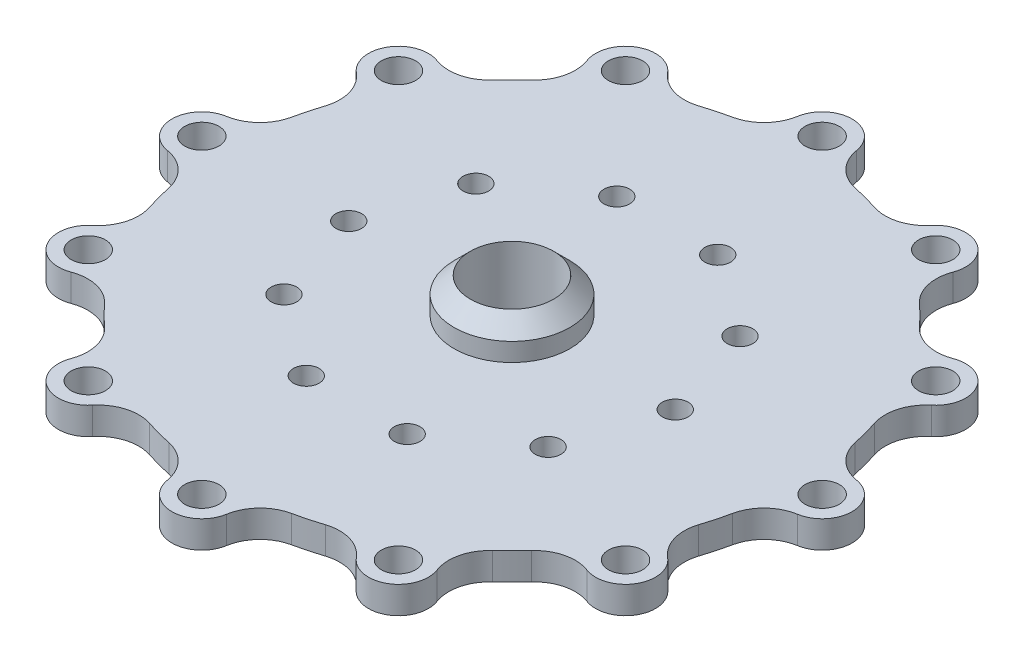
from build123d import *

# Parameters (mm, degrees)
CHAMFER1_SIZE      = 3.81
HOLE2_D            = 6
CIRPATTERN2_COUNT  = 10
HOLE4_D            = 8
CIRPATTERN4_COUNT  = 12
CUT_EXTRUDE3_REACH = 116.288
CIRPATTERN5_COUNT  = 12


with BuildPart() as part:
    # Sketch1 → Revolve1 (revolve)
    with BuildSketch(Plane.XY):
        Polygon((79.375, 10.68578), (79.375, 17.03578), (13.52042, 17.03578), (13.52042, 25.13076), (9.71042, 25.13076), (9.71042, 0), (14.14526, -4.43484), (19.22526, -4.43484), (19.22526, 10.68578), align=None)
    revolve(axis=Axis((0, 0, 0), (0, 1, 0)))

    # Chamfer1
    chamfer1_edges = [part.edges().sort_by_distance(p)[0] for p in [
        (-13.52042, 25.13076, 0),
    ]]
    chamfer(chamfer1_edges, length=CHAMFER1_SIZE - 0.0001)  # a hair under: the kernel refuses the full size

    # Hole2 (through all)
    with Locations(Plane(origin=(0, 17.03578, 0), x_dir=(1, 0, 0), z_dir=(0, 1, 0))):
        with Locations((38.1, 0)):
            hole2 = Hole(HOLE2_D / 2)

    # CirPattern2: Hole2 ×10 about axis
    cirpattern2_axis = Axis((0, 0, 0), (0, 1, 0))
    for i in range(1, CIRPATTERN2_COUNT):
        add(hole2.rotate(cirpattern2_axis, i * 360 / CIRPATTERN2_COUNT), mode=Mode.SUBTRACT)

    # Hole4 (through all)
    with Locations(Plane.XZ.offset(-10.68578)):
        with Locations((72.39, 0)):
            hole4 = Hole(HOLE4_D / 2)

    # CirPattern4: Hole4 ×12 about axis
    cirpattern4_axis = Axis((0, 0, 0), (0, 1, 0))
    for i in range(1, CIRPATTERN4_COUNT):
        add(hole4.rotate(cirpattern4_axis, i * 360 / CIRPATTERN4_COUNT), mode=Mode.SUBTRACT)

    # Sketch17 → Cut-Extrude3 (cut, up to next)
    with BuildSketch(Plane(origin=(0, 17.03578, 0), x_dir=(1, 0, 0), z_dir=(0, 1, 0)), mode=Mode.PRIVATE) as cut_extrude3_sk1:
        with BuildLine():
            ThreePointArc((79.375, 0), (77.717548697, 4.517460557), (73.531778846, 6.891049707))
            ThreePointArc((73.531778846, 6.891049707), (68.521982999, 9.388428721), (65.780227273, 14.268770092))
            ThreePointArc((65.780227273, 14.268770092), (65.016467368, 17.421109926), (64.101732931, 20.532996256))
            ThreePointArc((64.101732931, 20.532996256), (64.035992356, 26.130373726), (67.12591332, 30.798065318))
            ThreePointArc((67.12591332, 30.798065318), (69.56410177, 34.946538746), (68.740766425, 39.6875))
            ThreePointArc((68.740766425, 39.6875), (76.670362462, 20.543761705), (79.375, 0))
        make_face()
    cut_extrude3_tool1 = extrude(cut_extrude3_sk1.sketch, amount=-CUT_EXTRUDE3_REACH, mode=Mode.PRIVATE) & part.part
    cut_extrude3 = cut_extrude3_tool1.solids().sort_by_distance((71.346501, 17.03578, -19.117237))[0]
    add(cut_extrude3, mode=Mode.SUBTRACT)

    # CirPattern5: Cut-Extrude3 ×12 about axis
    cirpattern5_axis = Axis((0, 0, 0), (0, 1, 0))
    for i in range(1, CIRPATTERN5_COUNT):
        add(cut_extrude3.rotate(cirpattern5_axis, i * 360 / CIRPATTERN5_COUNT), mode=Mode.SUBTRACT)


solid = part.part
